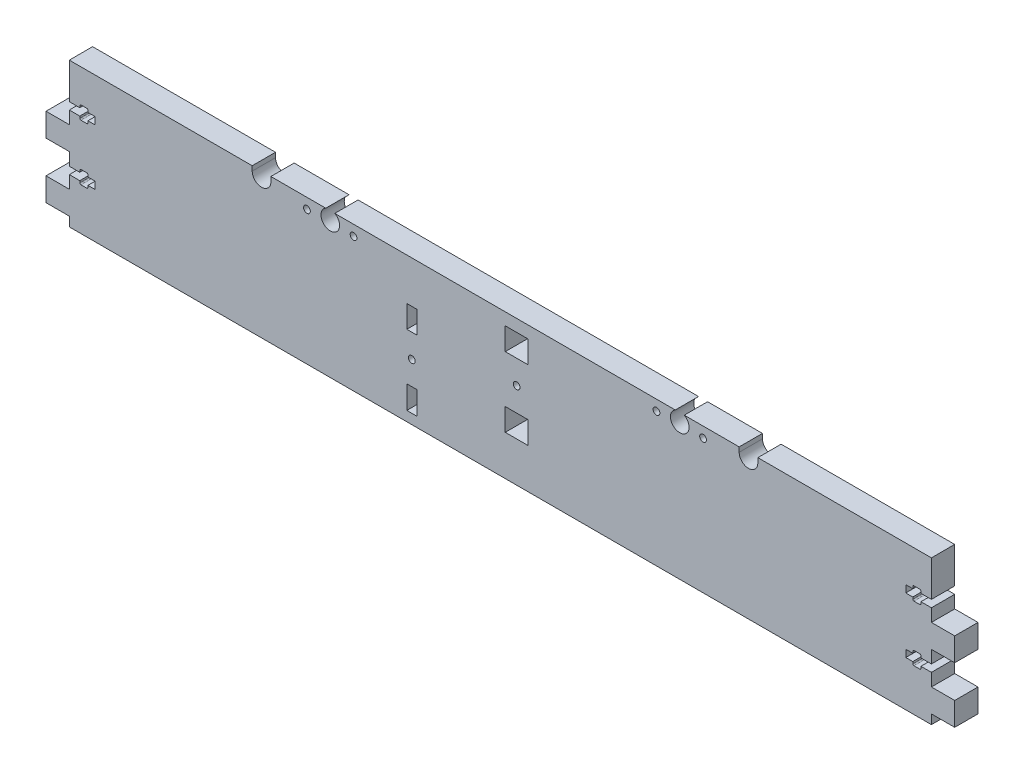
from build123d import *

# Parameters (mm, degrees)
MAINBODY_DEPTH      = 10
SCREWCUTOUTS_DEPTH  = 205.863369102
SKETCH2_R           = 4
SKETCH2_R_2         = 1.45
RODCUTOUTS_DEPTH    = 205.863369102
SKETCH4_R           = 1.45
SKETCH4_W           = 9.8
SKETCH4_H           = 9.6
CUT_EXTRUDE3_DEPTH  = 205.863369102
SKETCH5_R           = 1.45
SKETCH5_W           = 4.3
SKETCH5_H           = 9.6
SKETCH5_H_2         = 9.9
ENDSTOPHOLDER_DEPTH = 205.863369102
CUT_EXTRUDE4_DEPTH  = 205.863369102


with BuildPart() as part:
    # Sketch1 → MainBody (new body)
    with BuildSketch(Plane.XY):
        Polygon((0, 0), (-185, 0), (-185, -24), (-195, -24), (-195, -34), (-185, -34), (-185, -48), (-195, -48), (-195, -58), (-185, -58), (-185, -62), (0, -62), align=None)
    mainbody = extrude(amount=MAINBODY_DEPTH)

    # Sketch3 → ScrewCutouts (cut, through all)
    with BuildSketch(Plane.XY.offset(10)):
        with BuildLine():
            Line((-185, -18.55), (-180.5, -18.55))
            Line((-180.5, -18.55), (-180.5, -19.35))
            ThreePointArc((-180.5, -19.35), (-180.353553391, -19.703553391), (-180, -19.85))
            Line((-180, -19.85), (-177.5, -19.85))
            ThreePointArc((-177.5, -19.85), (-177.146446609, -19.703553391), (-177, -19.35))
            Line((-177, -19.35), (-177, -18.55))
            Line((-177, -18.55), (-174, -18.55))
            Line((-174, -18.55), (-174, -15.45))
            Line((-174, -15.45), (-177, -15.45))
            Line((-177, -15.45), (-177, -14.65))
            ThreePointArc((-177, -14.65), (-177.146446609, -14.296446609), (-177.5, -14.15))
            Line((-177.5, -14.15), (-180, -14.15))
            ThreePointArc((-180, -14.15), (-180.353553391, -14.296446609), (-180.5, -14.65))
            Line((-180.5, -14.65), (-180.5, -15.45))
            Line((-180.5, -15.45), (-185, -15.45))
            Line((-185, -15.45), (-185, -18.55))
        make_face()
        with BuildLine():
            Line((-185, -39.45), (-185, -42.55))
            Line((-185, -42.55), (-180.5, -42.55))
            Line((-180.5, -42.55), (-180.5, -43.35))
            ThreePointArc((-180.5, -43.35), (-180.353553391, -43.703553391), (-180, -43.85))
            Line((-180, -43.85), (-177.5, -43.85))
            ThreePointArc((-177.5, -43.85), (-177.146446609, -43.703553391), (-177, -43.35))
            Line((-177, -43.35), (-177, -42.55))
            Line((-177, -42.55), (-174, -42.55))
            Line((-174, -42.55), (-174, -39.45))
            Line((-174, -39.45), (-177, -39.45))
            Line((-177, -39.45), (-177, -38.65))
            ThreePointArc((-177, -38.65), (-177.146446609, -38.296446609), (-177.5, -38.15))
            Line((-177.5, -38.15), (-180, -38.15))
            ThreePointArc((-180, -38.15), (-180.353553391, -38.296446609), (-180.5, -38.65))
            Line((-180.5, -38.65), (-180.5, -39.45))
            Line((-180.5, -39.45), (-185, -39.45))
        make_face()
    screwcutouts = extrude(amount=-SCREWCUTOUTS_DEPTH, mode=Mode.SUBTRACT)

    # Mirror1: MainBody, ScrewCutouts across plane
    add(mainbody.mirror(Plane(origin=(0, 0, 0), x_dir=(0, 0, 1), z_dir=(1, 0, 0))))
    add(screwcutouts.mirror(Plane(origin=(0, 0, 0), x_dir=(0, 0, 1), z_dir=(1, 0, 0))), mode=Mode.SUBTRACT)

    # Sketch2 → RodCutouts (cut, through all)
    with BuildSketch(Plane.XY.offset(10)):
        with Locations((-73, -3.5)):
            Circle(SKETCH2_R)
        with Locations((-83, -4.5)):
            Circle(SKETCH2_R_2)
        with Locations((-63, -4.5)):
            Circle(SKETCH2_R_2)
        with Locations((67, -4.5)):
            Circle(SKETCH2_R_2)
        with Locations((87, -4.5)):
            Circle(SKETCH2_R_2)
        with Locations((77, -3.5)):
            Circle(SKETCH2_R)
    extrude(amount=-RODCUTOUTS_DEPTH, mode=Mode.SUBTRACT)

    # Sketch4 → Cut-Extrude3 (cut, through all)
    with BuildSketch(Plane.XY.offset(10)):
        with Locations((7, -25)):
            Circle(SKETCH4_R)
        with Locations((7, -10)):
            Rectangle(SKETCH4_W, SKETCH4_H)
        with Locations((7, -40)):
            Rectangle(SKETCH4_W, SKETCH4_H)
    extrude(amount=-CUT_EXTRUDE3_DEPTH, mode=Mode.SUBTRACT)

    # Sketch5 → EndstopHolder (cut, through all)
    with BuildSketch(Plane.XY.offset(10)):
        with Locations((-38, -37.75)):
            Circle(SKETCH5_R)
        with Locations((-38, -22.825)):
            Rectangle(SKETCH5_W, SKETCH5_H)
        with Locations((-38, -52.825)):
            Rectangle(SKETCH5_W, SKETCH5_H_2)
        with BuildLine():
            Line((-28.45, 8.994431211), (-28.45, 5))
            ThreePointArc((-28.45, 5), (-31.65, 1.8), (-34.85, 5))
            Line((-34.85, 5), (-34.85, 8.994431211))
            ThreePointArc((-34.85, 8.994431211), (-31.65, 12.194431211), (-28.45, 8.994431211))
        make_face()
    extrude(amount=-ENDSTOPHOLDER_DEPTH, mode=Mode.SUBTRACT)

    # Sketch7 → Cut-Extrude4 (cut, through all)
    with BuildSketch(Plane.XY.offset(10)):
        with BuildLine():
            Line((-98.5, 0), (-98.5, -2))
            ThreePointArc((-98.5, -2), (-102.5, -6), (-106.5, -2))
            Line((-106.5, -2), (-106.5, 0))
            ThreePointArc((-106.5, 0), (-102.5, 4), (-98.5, 0))
        make_face()
        with BuildLine():
            Line((102.5, 0), (102.5, -2))
            ThreePointArc((102.5, -2), (106.5, -6), (110.5, -2))
            Line((110.5, -2), (110.5, 0))
            ThreePointArc((110.5, 0), (106.5, 4), (102.5, 0))
        make_face()
    extrude(amount=-CUT_EXTRUDE4_DEPTH, mode=Mode.SUBTRACT)


solid = part.part
